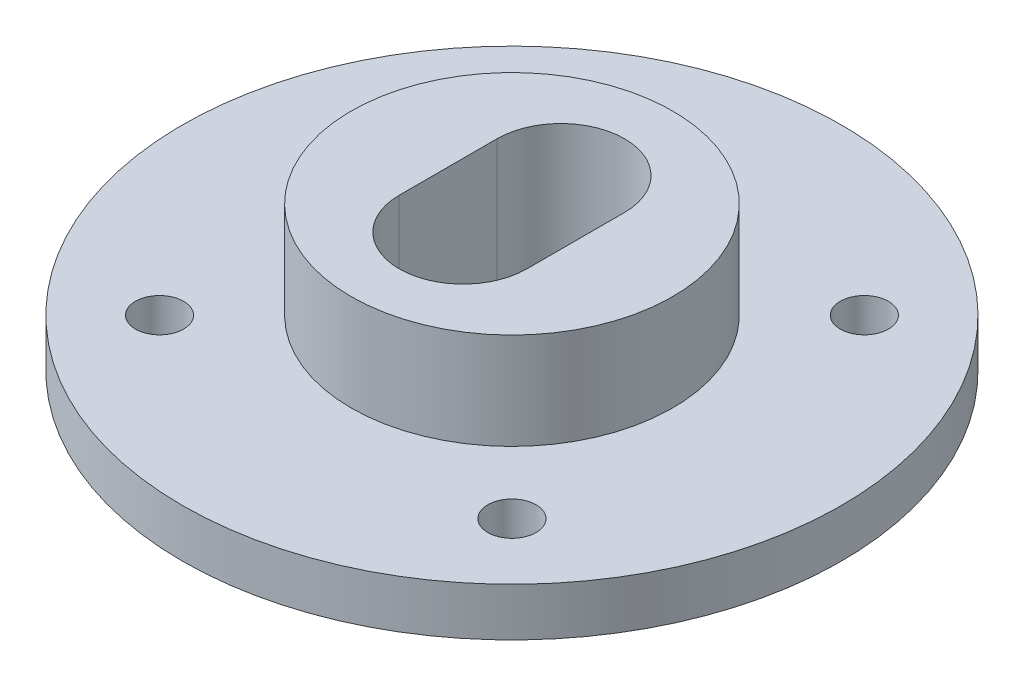
from build123d import *

# Parameters (mm, degrees)
SKETCH1_R           = 20.5
SKETCH1_R_2         = 1.5
BOSS_EXTRUDE1_DEPTH = 3
BOSS_EXTRUDE2_START = 6
SKETCH1_3_R         = 10
BOSS_EXTRUDE2_DEPTH = 6


with BuildPart() as part:
    # Sketch1 → Boss-Extrude1 (new body)
    with BuildSketch(Plane(origin=(0, 0, 0), x_dir=(1, 0, 0), z_dir=(0, 1, 0))):
        Circle(SKETCH1_R)
        with Locations((-10.960155108, -10.960155108)):
            Circle(SKETCH1_R_2, mode=Mode.SUBTRACT)
        with Locations((10.960155108, -10.960155108)):
            Circle(SKETCH1_R_2, mode=Mode.SUBTRACT)
        with Locations((-10.960155108, 10.960155108)):
            Circle(SKETCH1_R_2, mode=Mode.SUBTRACT)
        with Locations((10.960155108, 10.960155108)):
            Circle(SKETCH1_R_2, mode=Mode.SUBTRACT)
        with BuildLine():
            Line((3.96875, 3.041220715), (3.96875, -3.041220715))
            ThreePointArc((3.96875, -3.041220715), (0, -7.009970715), (-3.96875, -3.041220715))
            Line((-3.96875, -3.041220715), (-3.96875, 3.041220715))
            ThreePointArc((-3.96875, 3.041220715), (0, 7.009970715), (3.96875, 3.041220715))
        make_face(mode=Mode.SUBTRACT)
    extrude(amount=-BOSS_EXTRUDE1_DEPTH)

    # Sketch1<3> → Boss-Extrude2 (add)
    with BuildSketch(Plane(origin=(0, 0, 0), x_dir=(1, 0, 0), z_dir=(0, 1, 0)).offset(BOSS_EXTRUDE2_START)):
        Circle(SKETCH1_3_R)
        with BuildLine():
            Line((3.96875, 3.041220715), (3.96875, -3.041220715))
            ThreePointArc((3.96875, -3.041220715), (0, -7.009970715), (-3.96875, -3.041220715))
            Line((-3.96875, -3.041220715), (-3.96875, 3.041220715))
            ThreePointArc((-3.96875, 3.041220715), (0, 7.009970715), (3.96875, 3.041220715))
        make_face(mode=Mode.SUBTRACT)
    extrude(amount=-BOSS_EXTRUDE2_DEPTH)


solid = part.part
